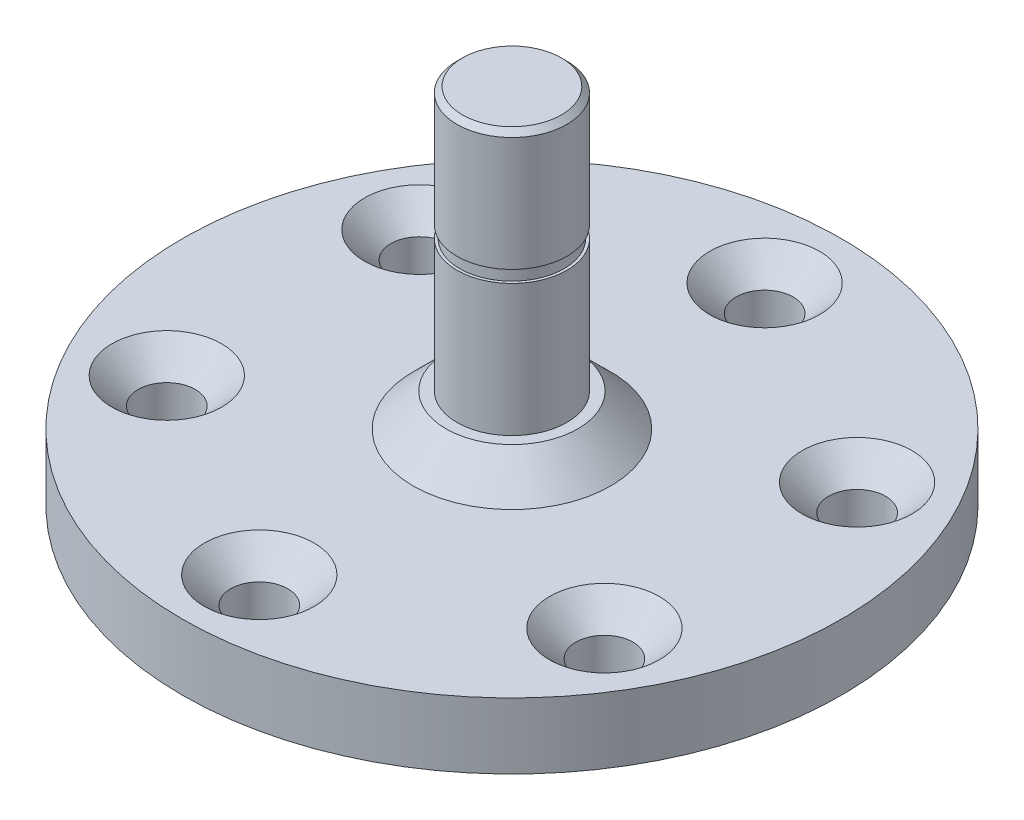
from build123d import *

# Parameters (mm, degrees)
SKETCH_1_R               = 30
EXTRUDE_1_DEPTH          = 6
SKETCH_2_R               = 6
EXTRUDE_2_DEPTH          = 3
SKETCH_3_R               = 5
EXTRUDE_3_DEPTH          = 24
CUT_EXTRUDE_START        = -12
SKETCH_4_OUTSIDE_W       = 80.208
SKETCH_4_OUTSIDE_H       = 80.208
SKETCH_4_OUTSIDE_R       = 4.75
CUT_EXTRUDE_1_DEPTH      = 1.1
SKETCH_5_R               = 2.6
CUT_EXTRUDE_2_DEPTH      = 51.289163843
CHAMFER_1_SIZE           = 3
CHAMFER_2_SIZE           = 0.5
SKETCH_6_R               = 13
CUT_EXTRUDE_3_DEPTH      = 1.2
PATTERN_CIRCULAR_1_COUNT = 6


with BuildPart() as part:
    # 草图1 → 凸台-拉伸1 (new body)
    with BuildSketch(Plane(origin=(0, 0, 0), x_dir=(1, 0, 0), z_dir=(0, 1, 0))):
        with Locations(Location((0, 0, 0), (0, 0, 270))):
            Circle(SKETCH_1_R)
    extrude(amount=EXTRUDE_1_DEPTH)

    # 草图2 → 凸台-拉伸2 (add)
    with BuildSketch(Plane(origin=(0, 6, 0), x_dir=(1, 0, 0), z_dir=(0, 1, 0))):
        with Locations(Location((0, 0, 0), (0, 0, 270))):
            Circle(SKETCH_2_R)
    extrude(amount=EXTRUDE_2_DEPTH)

    # 草图3 → 凸台-拉伸3 (add)
    with BuildSketch(Plane(origin=(0, 9, 0), x_dir=(1, 0, 0), z_dir=(0, 1, 0))):
        with Locations(Location((0, 0, 0), (0, 0, 270))):
            Circle(SKETCH_3_R)
    extrude(amount=EXTRUDE_3_DEPTH)

    # 草图4 outside → 切除-拉伸1 (cut)
    with BuildSketch(Plane(origin=(0, 33, 0), x_dir=(1, 0, 0), z_dir=(0, 1, 0)).offset(CUT_EXTRUDE_START)):
        Rectangle(SKETCH_4_OUTSIDE_W, SKETCH_4_OUTSIDE_H)
        with Locations(Location((0, 0, 0), (0, 0, 270))):
            Circle(SKETCH_4_OUTSIDE_R, mode=Mode.SUBTRACT)
    extrude(amount=CUT_EXTRUDE_1_DEPTH, mode=Mode.SUBTRACT)

    # 草图5 → 切除-拉伸2 (cut, through all)
    with BuildSketch(Plane(origin=(0, 6, 0), x_dir=(1, 0, 0), z_dir=(0, 1, 0))):
        with Locations(Location((0, 23, 0), (0, 0, 270))):
            Circle(SKETCH_5_R)
        with Locations(Location((19.918584287, 11.5, 0), (0, 0, 270))):
            Circle(SKETCH_5_R)
        with Locations(Location((19.918584287, -11.5, 0), (0, 0, 270))):
            Circle(SKETCH_5_R)
        with Locations(Location((0, -23, 0), (0, 0, 270))):
            Circle(SKETCH_5_R)
        with Locations(Location((-19.918584287, -11.5, 0), (0, 0, 270))):
            Circle(SKETCH_5_R)
        with Locations(Location((-19.918584287, 11.5, 0), (0, 0, 270))):
            Circle(SKETCH_5_R)
    extrude(amount=-CUT_EXTRUDE_2_DEPTH, mode=Mode.SUBTRACT)

    # 倒角1
    chamfer_1_edges = [part.edges().sort_by_distance(p)[0] for p in [
        (0, 6, -6),
    ]]
    chamfer(chamfer_1_edges, length=CHAMFER_1_SIZE - 0.0001)  # a hair under: the kernel refuses the full size

    # 倒角2
    chamfer_2_edges = [part.edges().sort_by_distance(p)[0] for p in [
        (0, 33, -5),
    ]]
    chamfer(chamfer_2_edges, length=CHAMFER_2_SIZE)

    # 草图6 → 切除-拉伸3 (cut)
    with BuildSketch(Plane.XZ):
        with Locations(Location((0, 0, 0), (0, 0, 270))):
            Circle(SKETCH_6_R)
    extrude(amount=-CUT_EXTRUDE_3_DEPTH, mode=Mode.SUBTRACT)

    # 草图7 → 切除-旋转1 (revolve, cut)
    with BuildSketch(Plane(origin=(0, 0, 0), x_dir=(0, 0, -1), z_dir=(1, 0, 0))):
        Polygon((-28, 6), (-23, 6), (-23, 1.9), (-23.9, 1.9), align=None)
    cut_revolve_1 = revolve(axis=Axis((0, 6, 23), (0, -1, 0)), mode=Mode.SUBTRACT)

    # 阵列(圆周)1: 切除-旋转1 ×6 about axis
    pattern_circular_1_axis = Axis((0, 0, 0), (0, 1, 0))
    for i in range(1, PATTERN_CIRCULAR_1_COUNT):
        add(cut_revolve_1.rotate(pattern_circular_1_axis, i * 360 / PATTERN_CIRCULAR_1_COUNT), mode=Mode.SUBTRACT)


solid = part.part
